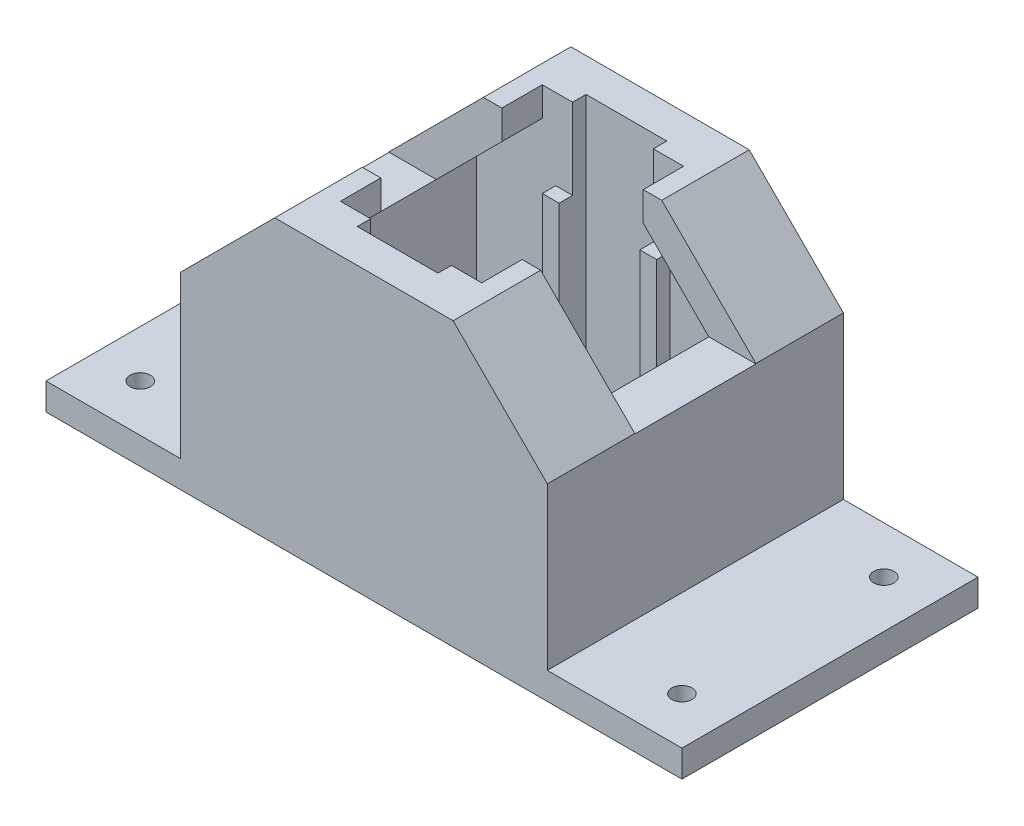
from build123d import *

# Parameters (mm, degrees)
SKETCH1_W           = 54.5
SKETCH1_H           = 44
BOSS_EXTRUDE1_DEPTH = 42
CHAMFER2_SIZE       = 14
CHAMFER3_SIZE       = 10
CHAMFER3_SIZE_2     = 7.071067812
BOSS_EXTRUDE2_DEPTH = 6
SKETCH4_W           = 20
SKETCH4_H           = 44
SKETCH4_R           = 1.5
BOSS_EXTRUDE3_DEPTH = 4
SKETCH5_W           = 21
SKETCH5_H           = 30
CUT_EXTRUDE1_DEPTH  = 12
SKETCH6_W           = 12
SKETCH6_H           = 42
CUT_EXTRUDE2_DEPTH  = 2


with BuildPart() as part:
    # Sketch1 → Boss-Extrude1 (new body)
    with BuildSketch(Plane(origin=(0, 0, 0), x_dir=(1, 0, 0), z_dir=(0, 1, 0))):
        Rectangle(SKETCH1_W, SKETCH1_H)
        Polygon((-6, 13), (-6, 15), (6, 15), (6, 13), (8.5, 13), (8.5, 15), (20.25, 15), (20.25, -15), (8.5, -15), (8.5, -13), (6, -13), (6, -15), (-6, -15), (-6, -13), (-8.5, -13), (-8.5, -15), (-20.25, -15), (-20.25, 15), (-8.5, 15), (-8.5, 13), align=None, mode=Mode.SUBTRACT)
    extrude(amount=BOSS_EXTRUDE1_DEPTH)

    # Chamfer2
    # the kernel refuses this chamfer: 14 mm, written as the material it takes off along each edge
    with BuildSketch(Plane(origin=(27.25, 42, 58.003561832), x_dir=(0.027495876610586365, -0.9996219169112968, 0), z_dir=(0, 0, -1)), Plane(origin=(-27.25, 42, -58.003561832), x_dir=(-0.027495876610586365, -0.9996219169112968, 0), z_dir=(0, 0, 1))) as chamfer2_piece_1:
        Polygon((CHAMFER2_SIZE * 0.999621916911, CHAMFER2_SIZE * 0.0274958766106), (-CHAMFER2_SIZE * 0.0274958766106, CHAMFER2_SIZE * 0.999621916911), (0, 0), align=None)
    extrude(amount=116.007123663, mode=Mode.SUBTRACT)

    # Chamfer3
    # the kernel refuses this chamfer: 10, 7.071067812 mm, written as the material it takes off along each edge
    with BuildSketch(Plane(origin=(20.25, 35, -15), x_dir=(0.7262819568769621, -0.6873969152643694, 0), z_dir=(0, 0, 1)), Plane(origin=(-20.25, 35, 15), x_dir=(-0.7262819568769624, -0.6873969152643691, 0), z_dir=(0, 0, -1))) as chamfer3_piece_1:
        Polygon((CHAMFER3_SIZE * 0.999621916911, -CHAMFER3_SIZE * 0.0274958766106), (CHAMFER3_SIZE_2 * 0.687396915251, -CHAMFER3_SIZE_2 * 0.726281956863), (0, 0), align=None)
    extrude(amount=30, mode=Mode.SUBTRACT)

    # Sketch2 → Boss-Extrude2 (add)
    with BuildSketch(Plane.XY.offset(-15)):
        Polygon((-27.25, 20.928932188), (-6.178932188, 42), (-13.25, 42), (-27.25, 28), align=None)
        Polygon((13.25, 42), (6.178932188, 42), (27.25, 20.928932188), (27.25, 28), align=None)
    boss_extrude2 = extrude(amount=BOSS_EXTRUDE2_DEPTH)

    # Mirror2: Boss-Extrude2 across plane
    add(boss_extrude2.mirror(Plane.XY))

    # Sketch4 → Boss-Extrude3 (add)
    # profile 1 of 2: a face of its own
    with BuildSketch(Plane.XZ):
        with Locations((37.25, 0)):
            Rectangle(SKETCH4_W, SKETCH4_H)
        with Locations(Location((40.25, 15, 0), (0, 0, 270))):
            Circle(SKETCH4_R, mode=Mode.SUBTRACT)
        with Locations(Location((40.25, -15, 0), (0, 0, 90))):
            Circle(SKETCH4_R, mode=Mode.SUBTRACT)
    # profile 2 of 2: a face of its own
    with BuildSketch(Plane.XZ):
        with Locations((-37.25, 0)):
            Rectangle(SKETCH4_W, SKETCH4_H)
        with Locations(Location((-40.25, -15, 0), (0, 0, 270))):
            Circle(SKETCH4_R, mode=Mode.SUBTRACT)
        with Locations(Location((-40.25, 15, 0), (0, 0, 90))):
            Circle(SKETCH4_R, mode=Mode.SUBTRACT)
    extrude(amount=-BOSS_EXTRUDE3_DEPTH)

    # Sketch5 → Cut-Extrude1 (cut)
    with BuildSketch(Plane(origin=(0, 42, 0), x_dir=(1, 0, 0), z_dir=(0, 1, 0))):
        Rectangle(SKETCH5_W, SKETCH5_H)
    extrude(amount=-CUT_EXTRUDE1_DEPTH, mode=Mode.SUBTRACT)

    # Sketch6 → Cut-Extrude2 (cut)
    with BuildSketch(Plane(origin=(0, 0, 15), x_dir=(-1, 0, 0), z_dir=(0, 0, -1))):
        with Locations((0, 21)):
            Rectangle(SKETCH6_W, SKETCH6_H)
    cut_extrude2 = extrude(amount=-CUT_EXTRUDE2_DEPTH, mode=Mode.SUBTRACT)

    # Mirror3: Cut-Extrude2 across plane
    add(cut_extrude2.mirror(Plane.XY), mode=Mode.SUBTRACT)


solid = part.part
